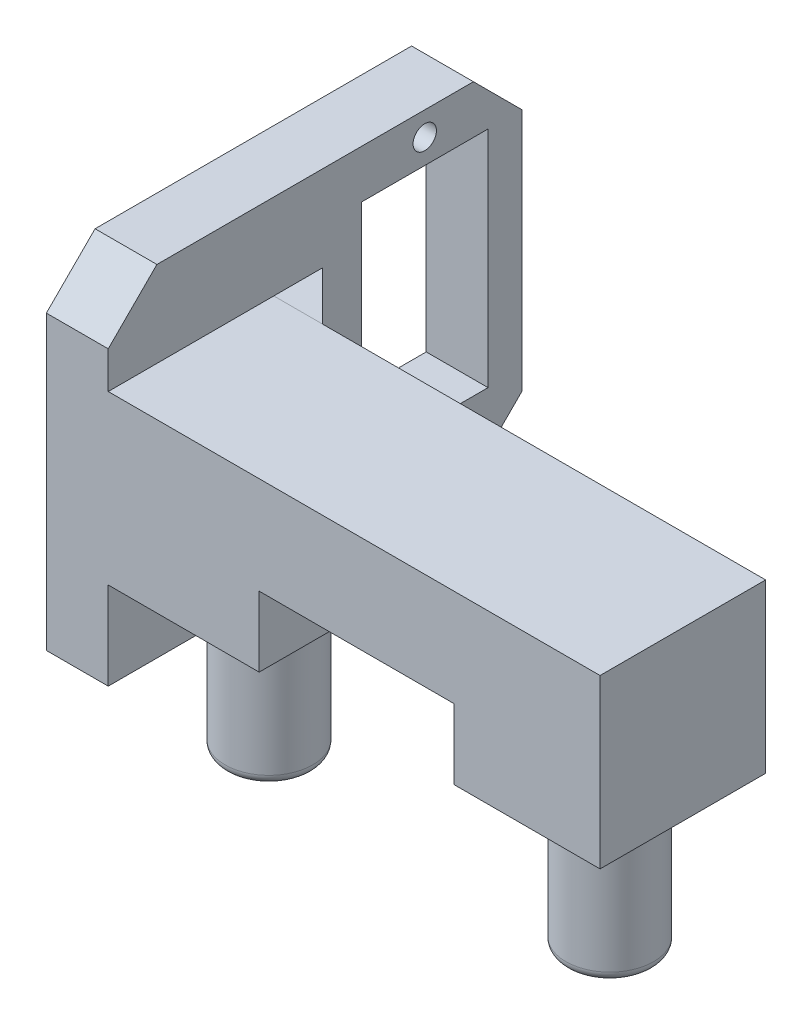
from build123d import *

# Parameters (mm, degrees)
SKETCH1_W            = 50.5
SKETCH1_H            = 17
BOSS_EXTRUDE1_DEPTH  = 10
SKETCH2_W            = 15.5
SKETCH2_H            = 17
SKETCH2_W_2          = 15
BOSS_EXTRUDE2_DEPTH  = 7.2
SKETCH5_W            = 42.5
SKETCH5_H            = 35
BOSS_EXTRUDE3_DEPTH  = 6.35
SKETCH6_W            = 13
SKETCH6_H            = 23
CUT_EXTRUDE1_DEPTH   = 6.35
M2_CLEARANCE_HOLE1_D = 2.4
CHAMFER1_SIZE        = 5
GUSSET1_START        = 7
GUSSET1_DEPTH        = 3
LPATTERN2_COUNT      = 3
LPATTERN2_PITCH      = 7
SKETCH10_R           = 4.5
BOSS_EXTRUDE4_DEPTH  = 15
FILLET1_R            = 1


# Read off the part's stored shape, not the designer's step: Gusset1
with BuildPart() as part:
    # Sketch1 → Boss-Extrude1 (new body)
    with BuildSketch(Plane(origin=(0, 0, 0), x_dir=(1, 0, 0), z_dir=(0, 1, 0))):
        Rectangle(SKETCH1_W, SKETCH1_H)
    extrude(amount=BOSS_EXTRUDE1_DEPTH)

    # Sketch2 → Boss-Extrude2 (add)
    with BuildSketch(Plane.XZ):
        with Locations((-17.5, 0)):
            Rectangle(SKETCH2_W, SKETCH2_H)
        with Locations((17.75, 0)):
            Rectangle(SKETCH2_W_2, SKETCH2_H)
    extrude(amount=BOSS_EXTRUDE2_DEPTH)

    # Sketch5 → Boss-Extrude3 (add)
    with BuildSketch(Plane.ZY.offset(25.25)):
        with Locations((-12.75, 1.3)):
            Rectangle(SKETCH5_W, SKETCH5_H)
    extrude(amount=BOSS_EXTRUDE3_DEPTH)

    # Sketch6 → Cut-Extrude1 (cut)
    with BuildSketch(Plane.ZY.offset(31.6)):
        with Locations((-24, 2.347)):
            Rectangle(SKETCH6_W, SKETCH6_H)
    extrude(amount=-CUT_EXTRUDE1_DEPTH, mode=Mode.SUBTRACT)

    # M2 Clearance Hole1 (through all)
    with Locations(Plane.ZY.offset(31.6)):
        with Locations((-24, 16.363), (-24, -11.437)):
            Hole(M2_CLEARANCE_HOLE1_D / 2)

    # Chamfer1
    chamfer1_edges = [part.edges().sort_by_distance(p)[0] for p in [
        (-28.425, 18.8, 8.5),
        (-28.425, 18.8, -34),
        (-28.425, -16.2, -34),
    ]]
    chamfer(chamfer1_edges, length=CHAMFER1_SIZE)

    # Sketch10 → Boss-Extrude4 (add)
    with BuildSketch(Plane.XZ.offset(7.2)):
        with Locations(Location((17.75, 0, 0), (0, 0, 90))):
            Circle(SKETCH10_R)
        with Locations(Location((-17.25, 0, 0), (0, 0, 90))):
            Circle(SKETCH10_R)
    extrude(amount=BOSS_EXTRUDE4_DEPTH)

    # Fillet1
    fillet1_edges = [part.edges().sort_by_distance(p)[0] for p in [
        (17.75, -22.2, -4.5),
        (-17.25, -22.2, -4.5),
    ]]
    fillet(fillet1_edges, radius=FILLET1_R)


with BuildPart() as body_2:
    # Gusset1 outline → Gusset1 (new body)
    with BuildSketch(Plane(origin=(0, 0, 0), x_dir=(1, 0, 0), z_dir=(0, 1, 0)).offset(GUSSET1_START)):
        Polygon((-20.25, 8.5), (-25.25, 13.5), (-25.25, 8.5), align=None)
    extrude(amount=GUSSET1_DEPTH)


with BuildPart() as lpattern2_1:
    # LPattern2: pattern copy
    add(body_2.part.moved(Location(Vector(0, -1, 0) * (1 * LPATTERN2_PITCH))))


with BuildPart() as lpattern2_2:
    # LPattern2: pattern copy
    add(body_2.part.moved(Location(Vector(0, -1, 0) * (2 * LPATTERN2_PITCH))))


solid = Compound([part.part, body_2.part, lpattern2_1.part, lpattern2_2.part])
